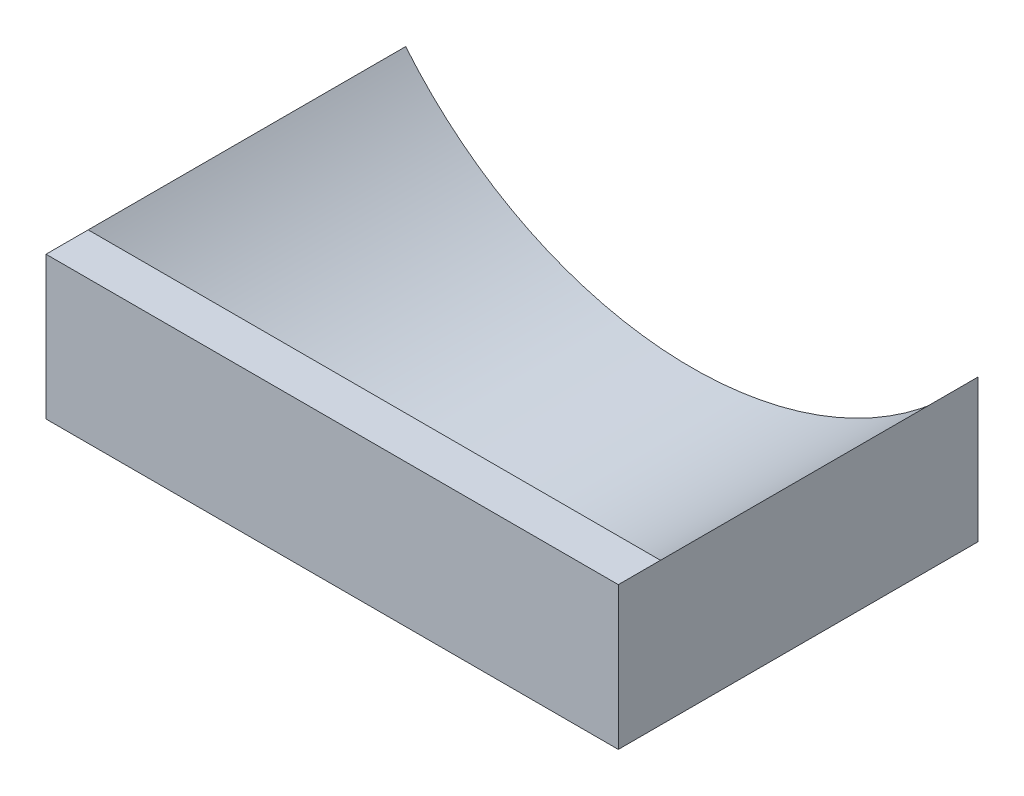
from build123d import *

# Parameters (mm, degrees)
BOSS_EXTRUDE1_DEPTH = 11.95
SKETCH2_W           = 21.541608956
SKETCH2_H           = 5.372271808
BOSS_EXTRUDE2_DEPTH = 1.5875


with BuildPart() as part:
    # Sketch1 → Boss-Extrude1 (new body)
    with BuildSketch(Plane.XY):
        with BuildLine():
            Line((-10.770804478, -8.865228192), (-10.770804478, -14.2375))
            Line((-10.770804478, -14.2375), (10.770804478, -14.2375))
            Line((10.770804478, -14.2375), (10.770804478, -8.865228192))
            ThreePointArc((10.770804478, -8.865228192), (0, -13.95), (-10.770804478, -8.865228192))
        make_face()
    extrude(amount=BOSS_EXTRUDE1_DEPTH)

    # Sketch2 → Boss-Extrude2 (add)
    with BuildSketch(Plane.XY.offset(11.95)):
        with Locations((0, -11.551364096)):
            Rectangle(SKETCH2_W, SKETCH2_H)
    extrude(amount=BOSS_EXTRUDE2_DEPTH)


solid = part.part
